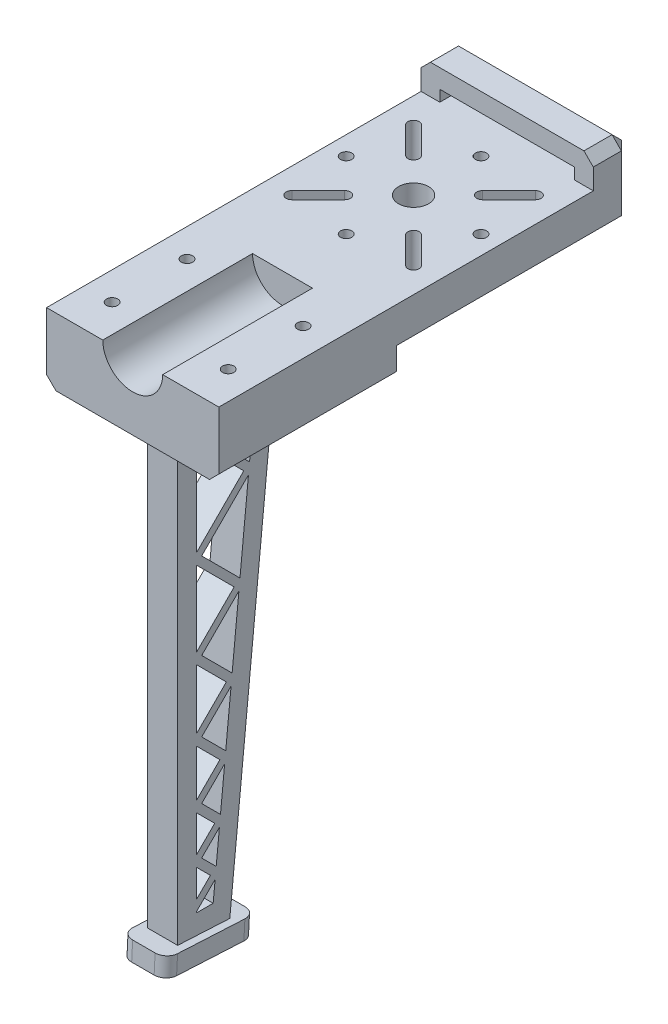
from build123d import *

# Parameters (mm, degrees)
Y_KSEKLIK_EKSTR_ZYON1_DEPTH = 40
IZIM2_W                     = 46
IZIM2_H                     = 18
Y_KSEKLIK_EKSTR_ZYON2_DEPTH = 70
IZIM3_W                     = 60
IZIM3_H                     = 6
KES_EKSTR_ZYON1_DEPTH       = 60
IZIM4_R                     = 4
IZIM4_R_2                   = 1.5
KES_EKSTR_ZYON2_DEPTH       = 60
Y_KSEKLIK_EKSTR_ZYON3_DEPTH = 46
PAH4_SIZE                   = 2.5
IZIM7_W                     = 5
IZIM7_H                     = 3
Y_KSEKLIK_EKSTR_ZYON4_DEPTH = 4
Y_KSEKLIK_EKSTR_ZYON5_DEPTH = 4
KES_EKSTR_ZYON4_DEPTH       = 10
RADYUS2_START               = -4
RADYUS2_DEPTH               = 8
RADYUS2_START_2             = -38.524937811
RADYUS2_2_DEPTH             = 35.524937811
RADYUS2_START_3             = -10
RADYUS2_3_DEPTH             = 20
Y_KSEKLIK_EKSTR_ZYON6_DEPTH = 8
IZIM12_W                    = 12
IZIM12_H                    = 24
Y_KSEKLIK_EKSTR_ZYON7_DEPTH = 5
RADYUS3_R                   = 3
IZIM13_R                    = 1.5
KES_EKSTR_ZYON5_DEPTH       = 35


with BuildPart() as part:
    # Çizim1 → Yükseklik-Ekstrüzyon1 (new body)
    with BuildSketch(Plane.XY):
        with BuildLine():
            Line((-8, 0), (-23, 0))
            Line((-23, 0), (-23, -18))
            Line((-23, -18), (23, -18))
            Line((23, -18), (23, 0))
            Line((23, 0), (8, 0))
            ThreePointArc((8, 0), (0, -8), (-8, 0))
        make_face()
    extrude(amount=-Y_KSEKLIK_EKSTR_ZYON1_DEPTH)

    # Çizim2 → Yükseklik-Ekstrüzyon2 (add)
    with BuildSketch(Plane(origin=(0, 0, -40), x_dir=(-1, 0, 0), z_dir=(0, 0, -1))):
        with Locations((0, -9)):
            Rectangle(IZIM2_W, IZIM2_H)
    extrude(amount=Y_KSEKLIK_EKSTR_ZYON2_DEPTH)

    # Çizim3 → Kes-Ekstrüzyon1 (cut)
    with BuildSketch(Plane(origin=(23, 0, 0), x_dir=(0, 0, -1), z_dir=(1, 0, 0))):
        with Locations((80, -15)):
            Rectangle(IZIM3_W, IZIM3_H)
    extrude(amount=-KES_EKSTR_ZYON1_DEPTH, mode=Mode.SUBTRACT)

    # Çizim4 → Kes-Ekstrüzyon2 (cut)
    with BuildSketch(Plane(origin=(0, 0, 0), x_dir=(1, 0, 0), z_dir=(0, 1, 0))):
        with Locations(Location((0, 75, 0), (0, 0, 180))):
            Circle(IZIM4_R)
        with Locations(Location((0, 57, 0), (0, 0, 180))):
            Circle(IZIM4_R_2)
        with Locations(Location((-18, 75, 0), (0, 0, 180))):
            Circle(IZIM4_R_2)
        with Locations(Location((0, 93, 0), (0, 0, 180))):
            Circle(IZIM4_R_2)
        with Locations(Location((18, 75, 0), (0, 0, 180))):
            Circle(IZIM4_R_2)
        with BuildLine():
            Line((-15.202795796, 92.324116139), (-8.131727984, 85.253048327))
            ThreePointArc((-8.131727984, 85.253048327), (-8.131727984, 83.131727984), (-10.253048327, 83.131727984))
            Line((-10.253048327, 83.131727984), (-17.324116139, 90.202795796))
            ThreePointArc((-17.324116139, 90.202795796), (-17.324116139, 92.324116139), (-15.202795796, 92.324116139))
        make_face()
        with BuildLine():
            Line((15.202795796, 92.324116139), (8.131727984, 85.253048327))
            ThreePointArc((8.131727984, 85.253048327), (8.131727984, 83.131727984), (10.253048327, 83.131727984))
            Line((10.253048327, 83.131727984), (17.324116139, 90.202795796))
            ThreePointArc((17.324116139, 90.202795796), (17.324116139, 92.324116139), (15.202795796, 92.324116139))
        make_face()
        with BuildLine():
            Line((17.324116139, 59.797204204), (10.253048327, 66.868272016))
            ThreePointArc((10.253048327, 66.868272016), (8.131727984, 66.868272016), (8.131727984, 64.746951673))
            Line((8.131727984, 64.746951673), (15.202795796, 57.675883861))
            ThreePointArc((15.202795796, 57.675883861), (17.324116139, 57.675883861), (17.324116139, 59.797204204))
        make_face()
        with BuildLine():
            Line((-15.202795796, 57.675883861), (-8.131727984, 64.746951673))
            ThreePointArc((-8.131727984, 64.746951673), (-8.131727984, 66.868272016), (-10.253048327, 66.868272016))
            Line((-10.253048327, 66.868272016), (-17.324116139, 59.797204204))
            ThreePointArc((-17.324116139, 59.797204204), (-17.324116139, 57.675883861), (-15.202795796, 57.675883861))
        make_face()
    extrude(amount=-KES_EKSTR_ZYON2_DEPTH, mode=Mode.SUBTRACT)

    # Çizim5 → Yükseklik-Ekstrüzyon3 (add)
    with BuildSketch(Plane(origin=(23, 0, 0), x_dir=(0, 0, -1), z_dir=(1, 0, 0))):
        Polygon((110, 0), (110, 8), (100, 8), (100, 3), (104, 3), (104, 0), align=None)
    extrude(amount=-Y_KSEKLIK_EKSTR_ZYON3_DEPTH)

    # Pah4
    pah4_edges = [part.edges().sort_by_distance(p)[0] for p in [
        (23, 8, -105),
        (0, 8, -110),
        (-23, 8, -105),
        (23, -2, -110),
        (-23, -2, -110),
        (0, -12, -110),
        (-23, -18, -25),
        (-23, -15, -50),
        (23, -18, -25),
        (-23, -12, -80),
        (0, -18, -50),
        (23, -15, -50),
        (23, -12, -80),
    ]]
    chamfer(pah4_edges, length=PAH4_SIZE)

    # Çizim7 → Yükseklik-Ekstrüzyon4 (add)
    with BuildSketch(Plane.XY.offset(-104)):
        with Locations((-20.5, 1.5)):
            Rectangle(IZIM7_W, IZIM7_H)
        with Locations((20.5, 1.5)):
            Rectangle(IZIM7_W, IZIM7_H)
    extrude(amount=Y_KSEKLIK_EKSTR_ZYON4_DEPTH)

    # Çizim9 → Yükseklik-Ekstrüzyon5 (add, symmetric)
    with BuildSketch(Plane(origin=(0, 0, 0), x_dir=(0, 0, -1), z_dir=(1, 0, 0))):
        Polygon((8, -18), (34, -18), (22, -138), (8, -138), align=None)
    extrude(amount=Y_KSEKLIK_EKSTR_ZYON5_DEPTH, both=True)

    # Çizim10 → Kes-Ekstrüzyon4 (cut)
    with BuildSketch(Plane(origin=(4, 0, 0), x_dir=(0, 0, -1), z_dir=(1, 0, 0))):
        Polygon((13, -132.742033617), (13, -133), (17.475062189, -133), (18.000954253, -127.741079364), (13.707106781, -132.034926836), align=None)
        Polygon((13, -122.42585543), (13, -129.913606492), (16.743875531, -126.169730961), align=None)
        Polygon((14.414213562, -121.011641868), (18.286653963, -124.884082268), (19.147196274, -116.278659157), align=None)
        Polygon((13, -109.817193202), (13, -119.597428306), (17.890117552, -114.707310754), align=None)
        Polygon((14.414213562, -108.40297964), (19.432895983, -113.421662061), (20.548158744, -102.269034459), align=None)
        Polygon((13, -94.406606035), (13, -106.988766077), (19.291080021, -100.697686056), align=None)
        Polygon((14.414213562, -92.992392472), (20.833858453, -99.412037363), (22.260446207, -85.146159828), align=None)
        Polygon((13, -75.571443941), (13, -91.57817891), (21.003367485, -83.574811425), align=None)
        Polygon((14.414213562, -74.157230378), (22.546145916, -82.289162732), (24.353241995, -64.218201946), align=None)
        Polygon((13, -52.55069027), (13, -72.743016816), (23.096163273, -62.646853543), align=None)
        Polygon((14.414213562, -51.136476708), (24.638941704, -61.36120485), (26.911103514, -38.639586757), align=None)
        Polygon((13, -24.414213562), (13, -49.722263146), (25.654024792, -37.068238354), align=None)
        Polygon((14.414213562, -23), (27.196803223, -35.782589661), (28.475062189, -23), align=None)
    extrude(amount=-KES_EKSTR_ZYON4_DEPTH, mode=Mode.SUBTRACT)

    # Radyus2: read off the stored shape, not the designer's step
    # Radyus2 outline → Radyus2 (add)
    with BuildSketch(Plane.YZ.offset(RADYUS2_START)):
        with BuildLine():
            Line((-18, -38.524937811), (-18, -34))
            Line((-18, -34), (-22.502481405, -33.54975186))
            ThreePointArc((-22.502481405, -33.54975186), (-19.292737332, -35.169911207), (-18, -38.524937811))
        make_face()
        with BuildLine():
            ThreePointArc((-18, -3), (-19.464466094, -6.535533906), (-23, -8))
            Line((-23, -8), (-18, -8))
            Line((-18, -8), (-18, -3))
        make_face()
    extrude(amount=RADYUS2_DEPTH)

    # Radyus2 2 outline → Radyus2 2 (add)
    with BuildSketch(Plane.XY.offset(RADYUS2_START_2)):
        with BuildLine():
            Line((4, -18), (4, -23))
            ThreePointArc((4, -23), (5.464466094, -19.464466094), (9, -18))
            Line((9, -18), (4, -18))
        make_face()
        with BuildLine():
            Line((-4, -23), (-4, -18))
            Line((-4, -18), (-9, -18))
            ThreePointArc((-9, -18), (-5.464466094, -19.464466094), (-4, -23))
        make_face()
    extrude(amount=RADYUS2_2_DEPTH)

    # Radyus2 3 outline → Radyus2 3 (cut)
    with BuildSketch(Plane.YZ.offset(RADYUS2_START_3)):
        with BuildLine():
            Line((-22.502481405, -33.54975186), (-23, -33.5))
            Line((-23, -33.5), (-23, -38.524937811))
            Line((-23, -38.524937811), (-18, -38.524937811))
            ThreePointArc((-18, -38.524937811), (-19.292737332, -35.169911207), (-22.502481405, -33.54975186))
        make_face()
        with BuildLine():
            Line((-23, -3), (-23, -8))
            ThreePointArc((-23, -8), (-19.464466094, -6.535533906), (-18, -3))
            Line((-18, -3), (-23, -3))
        make_face()
    extrude(amount=RADYUS2_3_DEPTH, mode=Mode.SUBTRACT)

    # Çizim11 → Yükseklik-Ekstrüzyon6 (add)
    with BuildSketch(Plane.ZY.offset(4)):
        Polygon((-22, -138), (-21.927011625, -138.729883751), (-8, -138), align=None)
    extrude(amount=-Y_KSEKLIK_EKSTR_ZYON6_DEPTH)

    # Çizim12 → Yükseklik-Ekstrüzyon7 (add)
    with BuildSketch(Plane(origin=(0, -137.203896927, 7.190551547), x_dir=(1, 0, 0), z_dir=(0, -0.9986295347545744, 0.05233595624293665))):
        with Locations((0, -22.184460391)):
            Rectangle(IZIM12_W, IZIM12_H)
    extrude(amount=Y_KSEKLIK_EKSTR_ZYON7_DEPTH)

    # Radyus3
    radyus3_edges = [part.edges().sort_by_distance(p)[0] for p in [
        (6, -141.489547187, -26.816220339),
        (6, -140.233484238, -2.849111505),
        (-6, -140.233484238, -2.849111505),
        (-6, -141.489547187, -26.816220339),
    ]]
    fillet(radyus3_edges, radius=RADYUS3_R)

    # Çizim13 → Kes-Ekstrüzyon5 (cut)
    with BuildSketch(Plane(origin=(0, 0, 0), x_dir=(1, 0, 0), z_dir=(0, 1, 0))):
        with Locations(Location((-15.5, 10, 0), (0, 0, 270))):
            Circle(IZIM13_R)
        with Locations(Location((-15.5, 30, 0), (0, 0, 270))):
            Circle(IZIM13_R)
        with Locations(Location((15.5, 30, 0), (0, 0, 90))):
            Circle(IZIM13_R)
        with Locations(Location((15.5, 10, 0), (0, 0, 90))):
            Circle(IZIM13_R)
    extrude(amount=-KES_EKSTR_ZYON5_DEPTH, mode=Mode.SUBTRACT)


solid = part.part
